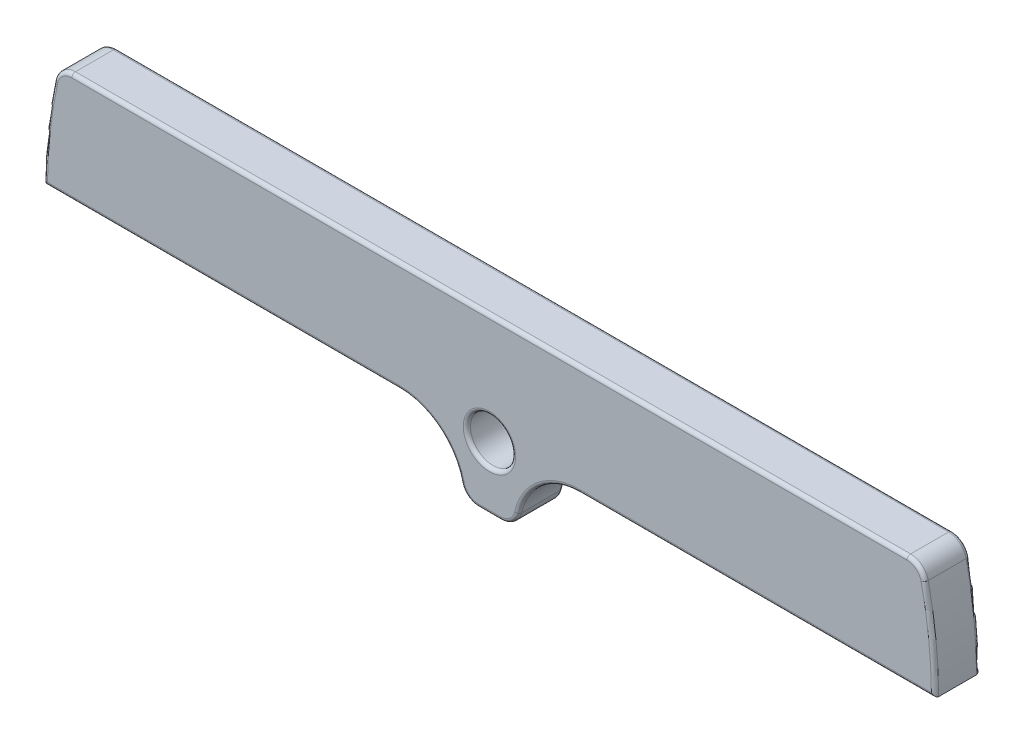
from build123d import *

# Parameters (mm, degrees)
SKETCH1_R      = 3.175
EXTRUDE1_DEPTH = 6.35
FILLET1_R      = 2.54
FILLET2_R      = 0.508


with BuildPart() as part:
    # Sketch1 → Extrude1 (new body)
    with BuildSketch(Plane.XY):
        with BuildLine():
            Line((0, 12.7), (50.00625, 12.7))
            ThreePointArc((50.00625, 12.7), (56.292429285, 10.096179285), (58.89625, 3.81))
            Line((58.89625, 3.81), (66.51625, 3.81))
            ThreePointArc((66.51625, 3.81), (69.120070715, 10.096179285), (75.40625, 12.7))
            Line((75.40625, 12.7), (125.4125, 12.7))
            ThreePointArc((125.4125, 12.7), (124.928274607, 20.477753076), (123.483076923, 28.135384615))
            Line((123.483076923, 28.135384615), (1.929423077, 28.135384615))
            ThreePointArc((1.929423077, 28.135384615), (0.484225393, 20.477753076), (0, 12.7))
        make_face()
        with Locations((62.70625, 12.7)):
            Circle(SKETCH1_R, mode=Mode.SUBTRACT)
    extrude(amount=EXTRUDE1_DEPTH)

    # Fillet1
    fillet1_edges = [part.edges().sort_by_distance(p)[0] for p in [
        (123.483076923, 28.135384615, 3.175),
        (1.929423077, 28.135384615, 3.175),
        (66.51625, 3.81, 3.175),
        (58.89625, 3.81, 3.175),
    ]]
    fillet(fillet1_edges, radius=FILLET1_R)

    # Fillet2
    fillet2_edges = [part.edges().sort_by_distance(p)[0] for p in [
        (59.53125, 12.7, 0),
        (100.409375, 12.7, 0),
        (125.047135491, 19.459274015, 0),
        (123.066310662, 27.574572114, 0),
        (62.70625, 28.135384615, 0),
        (2.346189338, 27.574572114, 0),
        (0.365364509, 19.459274015, 0),
        (25.003125, 12.7, 0),
        (55.550139028, 10.759632684, 0),
        (59.566486478, 4.364390662, 0),
        (62.70625, 3.81, 0),
        (65.846013522, 4.364390662, 0),
        (69.862360972, 10.759632684, 0),
        (59.53125, 12.7, 6.35),
        (59.566486478, 4.364390662, 6.35),
        (55.550139028, 10.759632684, 6.35),
        (25.003125, 12.7, 6.35),
        (0.365364509, 19.459274015, 6.35),
        (2.346189338, 27.574572114, 6.35),
        (62.70625, 28.135384615, 6.35),
        (123.066310662, 27.574572114, 6.35),
        (125.047135491, 19.459274015, 6.35),
        (100.409375, 12.7, 6.35),
        (69.862360972, 10.759632684, 6.35),
        (65.846013522, 4.364390662, 6.35),
        (62.70625, 3.81, 6.35),
    ]]
    fillet(fillet2_edges, radius=FILLET2_R)


solid = part.part
